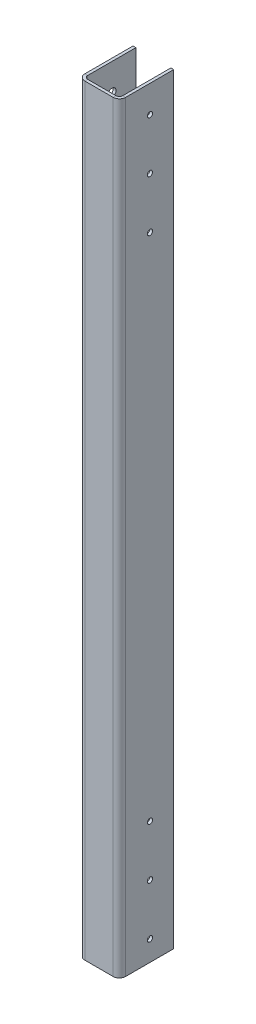
from build123d import *

# Parameters (mm, degrees)
SKETCH1_W                            = 38.1
SKETCH1_H                            = 749.3
BASE_FLANGE1_DEPTH                   = 2.65684
EDGE_FLANGE1_STRIP_W                 = 16.97736
EDGE_FLANGE1_STRIP_H                 = 2.65684
EDGE_FLANGE1_STRIP_CUT_DEPTH         = 749.3
EDGE_FLANGE1_STRIP_2_W               = 16.97736
EDGE_FLANGE1_STRIP_2_H               = 2.65684
EDGE_FLANGE1_STRIP_CUT_2_DEPTH       = 749.3
EDGE_FLANGE1_DEPTH                   = 749.3
EDGE_FLANGE1_BEND_DEPTH              = 749.3
CUT_EXTRUDE1_START                   = -38.1
CUT_EXTRUDE1_OUTLINE_W               = 50.8
CUT_EXTRUDE1_OUTLINE_H               = 38.1
CUT_EXTRUDE1_DEPTH                   = 38.1
F_10_0_1935_DIAMETER_HOLE1_D         = 4.9149
F_19_64_0_29688_DIAMETER_HOLE3_D     = 7.540752
F_19_64_0_29688_DIAMETER_HOLE3_DEPTH = 35.44216


# Read off the part's stored shape, not the designer's step: Cut-Extrude1
# Sheet-metal steps are written as plain solids
with BuildPart() as part:
    # Sketch1 → Base-Flange1 (new body)
    with BuildSketch(Plane.XY):
        with Locations((19.05, 276.978929766)):
            Rectangle(SKETCH1_W, SKETCH1_H)
    extrude(amount=-BASE_FLANGE1_DEPTH)

    # Edge-Flange1 strip (across the edge) → Edge-Flange1 strip cut (cut)
    with BuildSketch(Plane(origin=(38.1, 651.628929766, -2.65684), x_dir=(-1, 0, 0), z_dir=(0, -1, 0))):
        with Locations((-2.65684, -1.32842)):
            Rectangle(EDGE_FLANGE1_STRIP_W, EDGE_FLANGE1_STRIP_H)
    extrude(amount=EDGE_FLANGE1_STRIP_CUT_DEPTH, mode=Mode.SUBTRACT)

    # Edge-Flange1 strip 2 (across the edge) → Edge-Flange1 strip cut 2 (cut)
    with BuildSketch(Plane(origin=(0, -97.671070234, -2.65684), x_dir=(1, 0, 0), z_dir=(0, 1, 0))):
        with Locations((-2.65684, -1.32842)):
            Rectangle(EDGE_FLANGE1_STRIP_2_W, EDGE_FLANGE1_STRIP_2_H)
    extrude(amount=EDGE_FLANGE1_STRIP_CUT_2_DEPTH, mode=Mode.SUBTRACT)

    # Edge-Flange1 section (across the edge) → Edge-Flange1 (add)
    with BuildSketch(Plane(origin=(38.1, 651.628929766, -2.65684), x_dir=(-1, 0, 0), z_dir=(0, -1, 0))):
        with BuildLine():
            Line((0, 3.175), (0, 48.14316))
            Line((0, 48.14316), (2.65684, 48.14316))
            Line((2.65684, 48.14316), (2.65684, 3.175))
            ThreePointArc((2.65684, 3.175), (3.58677597, 0.92993597), (5.83184, 0))
            Line((5.83184, 0), (5.83184, -2.65684))
            ThreePointArc((5.83184, -2.65684), (1.708106389, -0.948733611), (0, 3.175))
        make_face()
    extrude(amount=EDGE_FLANGE1_DEPTH)

    # Edge-Flange1 section 2 (across the edge) → Edge-Flange1 bend (add)
    with BuildSketch(Plane(origin=(0, -97.671070234, -2.65684), x_dir=(1, 0, 0), z_dir=(0, 1, 0))):
        with BuildLine():
            Line((0, 3.175), (0, 48.14316))
            Line((0, 48.14316), (2.65684, 48.14316))
            Line((2.65684, 48.14316), (2.65684, 3.175))
            ThreePointArc((2.65684, 3.175), (3.58677597, 0.92993597), (5.83184, 0))
            Line((5.83184, 0), (5.83184, -2.65684))
            ThreePointArc((5.83184, -2.65684), (1.708106389, -0.948733611), (0, 3.175))
        make_face()
    extrude(amount=EDGE_FLANGE1_BEND_DEPTH)

    # Cut-Extrude1 outline → Cut-Extrude1 (cut)
    with BuildSketch(Plane(origin=(38.1, 0, 0), x_dir=(0, 0, -1), z_dir=(1, 0, 0)).offset(CUT_EXTRUDE1_START)):
        with Locations((25.4, 632.578929766)):
            Rectangle(CUT_EXTRUDE1_OUTLINE_W, CUT_EXTRUDE1_OUTLINE_H)
    extrude(amount=CUT_EXTRUDE1_DEPTH, mode=Mode.SUBTRACT)

    # #10 (0.1935) Diameter Hole1 (through all)
    with Locations(Plane(origin=(38.1, 0, 0), x_dir=(0, 0, -1), z_dir=(1, 0, 0))):
        with Locations((28.575, -78.621070234), (28.575, -30.996070234), (28.575, 16.628929766), (28.575, 588.128929766), (28.575, 540.503929766), (28.575, 492.878929766)):
            Hole(F_10_0_1935_DIAMETER_HOLE1_D / 2)

    # 19/64 (0.29688) Diameter Hole3
    with Locations(Plane.ZY):
        with Locations((-28.575, 588.128929766)):
            Hole(F_19_64_0_29688_DIAMETER_HOLE3_D / 2, depth=F_19_64_0_29688_DIAMETER_HOLE3_DEPTH)


solid = part.part
